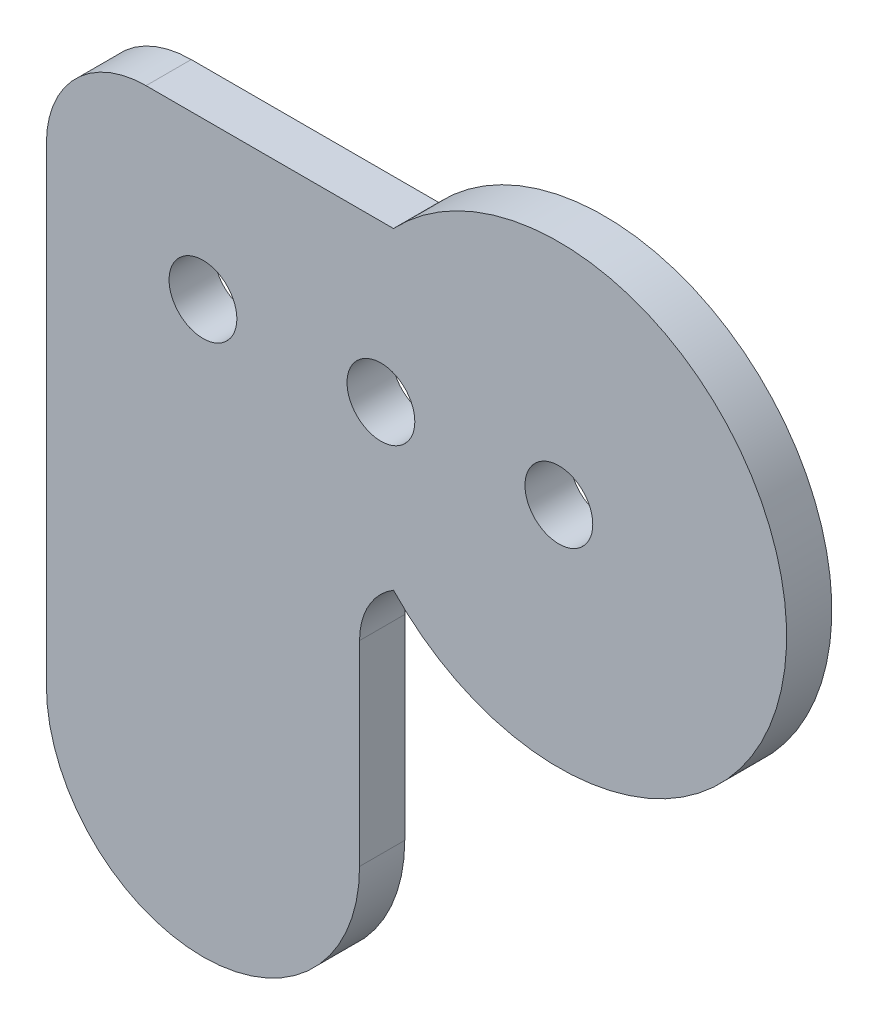
from build123d import *

# Parameters (mm, degrees)
BOSS_EXTRUDE1_DEPTH = 3.175
FILLET1_R           = 7
FILLET2_R           = 5
SKETCH2_R           = 2.38125
CUT_EXTRUDE1_DEPTH  = 54.908075694
LPATTERN1_COUNT     = 3
LPATTERN1_PITCH     = 12.5


with BuildPart() as part:
    # Sketch1 → Boss-Extrude1 (new body)
    with BuildSketch(Plane.XY):
        with BuildLine():
            Line((-11.618950039, 11), (-36, 11))
            Line((-36, 11), (-36, -29))
            ThreePointArc((-36, -29), (-25, -40), (-14, -29))
            Line((-14, -29), (-14, -11))
            Line((-14, -11), (-11.618950039, -11))
            ThreePointArc((-11.618950039, -11), (16, 0), (-11.618950039, 11))
        make_face()
    extrude(amount=BOSS_EXTRUDE1_DEPTH)

    # Fillet1
    fillet1_edges = [part.edges().sort_by_distance(p)[0] for p in [
        (-36, 11, 1.5875),
    ]]
    fillet(fillet1_edges, radius=FILLET1_R)

    # Fillet2
    # the kernel refuses this fillet: 5 mm, written as the material it adds along each edge
    with BuildSketch(Plane(origin=(-14, -11, 0), x_dir=(1, 0, 0), z_dir=(0, 0, 1))) as fillet2_piece_1:
        with BuildLine():
            CenterArc((5, -4.259237102), FILLET2_R, 121.586822832, 58.413177168)
            Line((0, -4.259237102), (-0.1, -4.259237102))
            Line((-0.1, -4.259237102), (-0.1, 0))
            Line((-0.1, 0), (0, 0.1))
            ThreePointArc((0, 0.1), (1.190524981, 0.1), (2.328670961, 0.085184742))
            Line((2.328670961, 0.085184742), (2.381049961, 0))
        make_face()
    extrude(amount=3.175)

    # Sketch2 → Cut-Extrude1 (cut, through all)
    with BuildSketch(Plane.XY.offset(3.175)):
        Circle(SKETCH2_R)
    cut_extrude1 = extrude(amount=-CUT_EXTRUDE1_DEPTH, mode=Mode.SUBTRACT)

    # LPattern1: Cut-Extrude1 ×3
    with Locations(*[(-i * LPATTERN1_PITCH, 0, 0) for i in range(1, LPATTERN1_COUNT)]):
        add(cut_extrude1, mode=Mode.SUBTRACT)


solid = part.part
